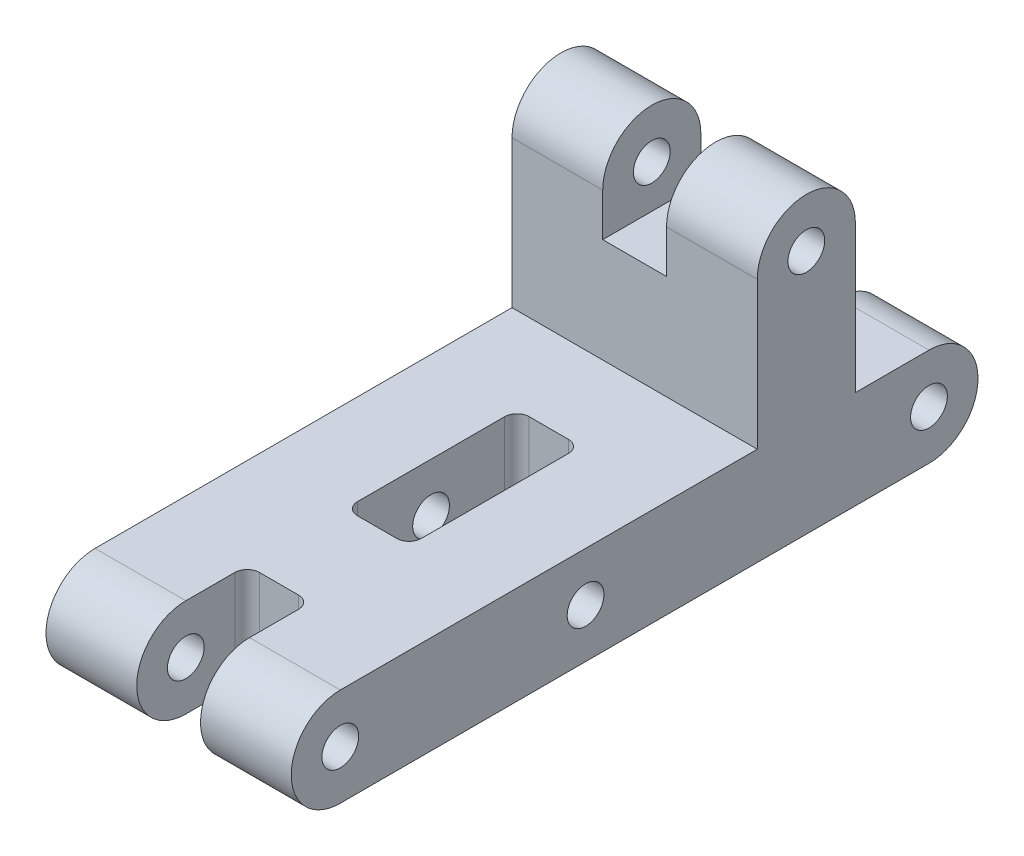
from build123d import *

# Parameters (mm, degrees)
CROQUIS1_R              = 1.5
SALIENTE_EXTRUIR1_DEPTH = 10
CROQUIS2_W              = 8
CROQUIS2_H              = 7.5
CROQUIS2_W_2            = 14
CROQUIS2_H_2            = 8
CROQUIS2_W_3            = 9
CORTAR_EXTRUIR1_DEPTH   = 2.6
REDONDEO1_R             = 1


with BuildPart() as part:
    # Croquis1 → Saliente-Extruir1 (new, symmetric)
    with BuildSketch(Plane(origin=(0, 0, 0), x_dir=(0, 0, -1), z_dir=(1, 0, 0))):
        with BuildLine():
            Line((-14, 4), (0, 4))
            Line((0, 4), (0, 16))
            ThreePointArc((0, 16), (4, 20), (8, 16))
            Line((8, 16), (8, 4))
            Line((8, 4), (14, 4))
            ThreePointArc((14, 4), (18, 0), (14, -4))
            Line((14, -4), (-14, -4))
            Line((-14, -4), (-34, -4))
            ThreePointArc((-34, -4), (-38, 0), (-34, 4))
            Line((-34, 4), (-14, 4))
        make_face()
        with Locations((14, 0)):
            Circle(CROQUIS1_R, mode=Mode.SUBTRACT)
        with Locations((4, 16)):
            Circle(CROQUIS1_R, mode=Mode.SUBTRACT)
        with Locations((-14, 0)):
            Circle(CROQUIS1_R, mode=Mode.SUBTRACT)
        with Locations((-34, 0)):
            Circle(CROQUIS1_R, mode=Mode.SUBTRACT)
    extrude(amount=SALIENTE_EXTRUIR1_DEPTH, both=True)

    # Croquis2 → Cortar-Extruir1 (cut, symmetric)
    with BuildSketch(Plane(origin=(0, 0, 0), x_dir=(0, 0, -1), z_dir=(1, 0, 0))):
        with Locations((4, 16.25)):
            Rectangle(CROQUIS2_W, CROQUIS2_H)
        with Locations((-14, 0)):
            Rectangle(CROQUIS2_W_2, CROQUIS2_H_2)
        with Locations((13.5, 0)):
            Rectangle(CROQUIS2_W_3, CROQUIS2_H_2)
        with Locations((-33.5, 0)):
            Rectangle(CROQUIS2_W_3, CROQUIS2_H_2)
    extrude(amount=CORTAR_EXTRUIR1_DEPTH, both=True, mode=Mode.SUBTRACT)

    # Redondeo1
    redondeo1_edges = [part.edges().sort_by_distance(p)[0] for p in [
        (2.6, 0, 7),
        (2.6, 0, 21),
        (-2.6, 0, 7),
        (-2.6, 0, 21),
        (2.6, 0, 29),
        (-2.6, 0, 29),
        (2.6, 0, -9),
        (-2.6, 0, -9),
    ]]
    fillet(redondeo1_edges, radius=REDONDEO1_R)


solid = part.part
